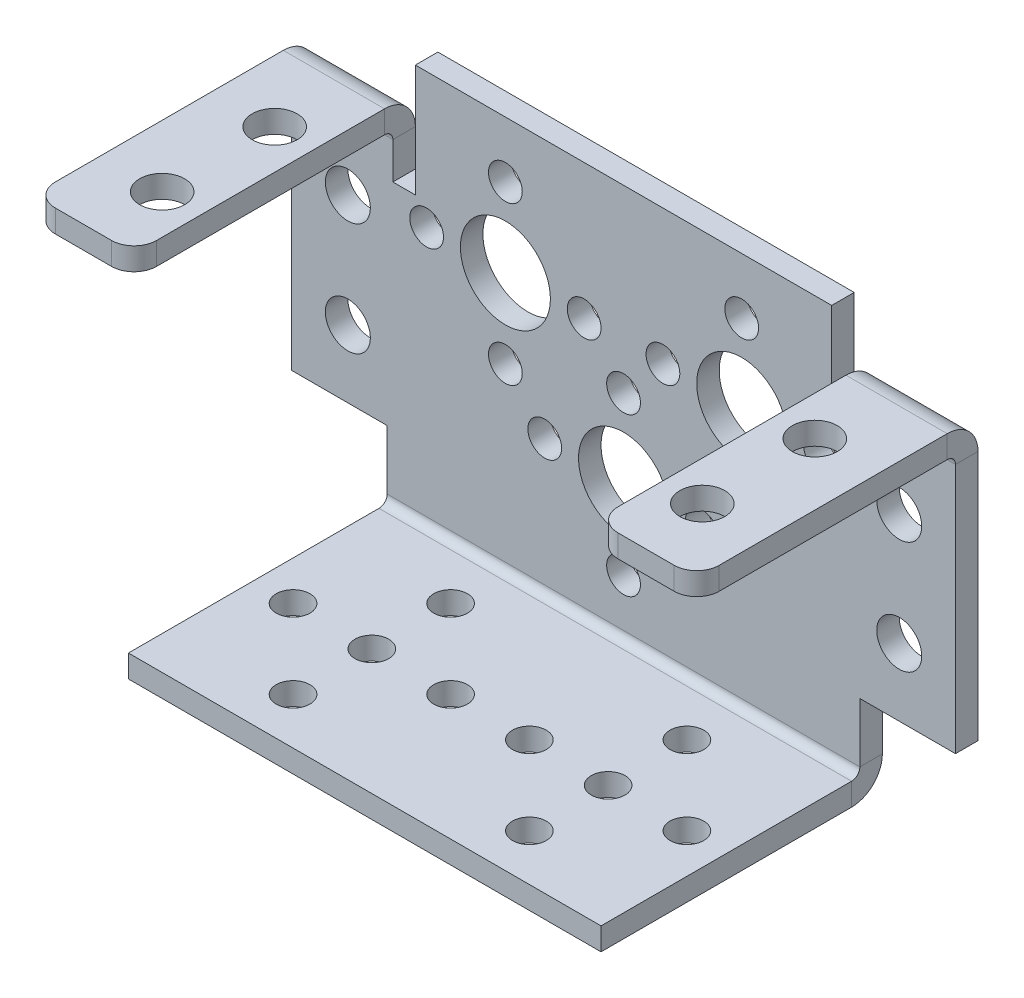
from build123d import *

# Parameters (mm, degrees)
SKETCH_1_R                         = 4
SKETCH_1_R_2                       = 1.5
SKETCH_1_R_3                       = 2
SM_BASE_FLANGE_1_DEPTH             = 2
SM_EDGE_FLANGE_1_STRIP_W           = 9.4732
SM_EDGE_FLANGE_1_STRIP_H           = 2
SM_EDGE_FLANGE_1_STRIP_CUT_DEPTH   = 9
SM_EDGE_FLANGE_1_STRIP_2_W         = 9.4732
SM_EDGE_FLANGE_1_STRIP_2_H         = 2
SM_EDGE_FLANGE_1_STRIP_CUT_2_DEPTH = 9
SM_EDGE_FLANGE_1_DEPTH             = 9
SM_EDGE_FLANGE_1_BEND_DEPTH        = 9
SM_EDGE_FLANGE_2_STRIP_W           = 9.4732
SM_EDGE_FLANGE_2_STRIP_H           = 2
SM_EDGE_FLANGE_2_STRIP_CUT_DEPTH   = 42
SM_EDGE_FLANGE_2_DEPTH             = 42
SKETCH_15_R                        = 1.5
CUT_EXTRUDE_1_DEPTH                = 10
SKETCH_16_R                        = 2
CUT_EXTRUDE_2_DEPTH                = 10
FILLET_1_R                         = 2


# Sheet-metal steps are written as plain solids
with BuildPart() as part:
    # Sketch 1 → 基体-法兰1 (new body)
    with BuildSketch(Plane.XY):
        Polygon((0, 0), (9, 0), (9, -6), (11, -6), (11, 4), (48, 4), (48, -6), (50, -6), (50, 0), (59, 0), (59, -25), (50.5, -25), (50.5, -33), (8.5, -33), (8.5, -25), (0, -25), align=None)
        with Locations((19, -8)):
            Circle(SKETCH_1_R, mode=Mode.SUBTRACT)
        with Locations((40, -8)):
            Circle(SKETCH_1_R, mode=Mode.SUBTRACT)
        with Locations((29.5, -19)):
            Circle(SKETCH_1_R, mode=Mode.SUBTRACT)
        with Locations((19, -1)):
            Circle(SKETCH_1_R_2, mode=Mode.SUBTRACT)
        with Locations((19, -15)):
            Circle(SKETCH_1_R_2, mode=Mode.SUBTRACT)
        with Locations((26, -8)):
            Circle(SKETCH_1_R_2, mode=Mode.SUBTRACT)
        with Locations((12, -8)):
            Circle(SKETCH_1_R_2, mode=Mode.SUBTRACT)
        with Locations(Location((33, -8, 0), (0, 0, 180))):
            Circle(SKETCH_1_R_2, mode=Mode.SUBTRACT)
        with Locations(Location((40, -15, 0), (0, 0, 180))):
            Circle(SKETCH_1_R_2, mode=Mode.SUBTRACT)
        with Locations(Location((47, -8, 0), (0, 0, 180))):
            Circle(SKETCH_1_R_2, mode=Mode.SUBTRACT)
        with Locations(Location((40, -1, 0), (0, 0, 180))):
            Circle(SKETCH_1_R_2, mode=Mode.SUBTRACT)
        with Locations((29.5, -12)):
            Circle(SKETCH_1_R_2, mode=Mode.SUBTRACT)
        with Locations((36.5, -19)):
            Circle(SKETCH_1_R_2, mode=Mode.SUBTRACT)
        with Locations((29.5, -26)):
            Circle(SKETCH_1_R_2, mode=Mode.SUBTRACT)
        with Locations((22.5, -19)):
            Circle(SKETCH_1_R_2, mode=Mode.SUBTRACT)
        with Locations((54, -9)):
            Circle(SKETCH_1_R_3, mode=Mode.SUBTRACT)
        with Locations((54, -19)):
            Circle(SKETCH_1_R_3, mode=Mode.SUBTRACT)
        with Locations((5, -19)):
            Circle(SKETCH_1_R_3, mode=Mode.SUBTRACT)
        with Locations((5, -9)):
            Circle(SKETCH_1_R_3, mode=Mode.SUBTRACT)
    extrude(amount=-SM_BASE_FLANGE_1_DEPTH)

    # 边线-法兰1 strip (across the edge) → 边线-法兰1 strip cut (cut)
    with BuildSketch(Plane(origin=(59, 0, 0), x_dir=(0, -1, 0), z_dir=(-1, 0, 0))):
        with Locations((-2, -1)):
            Rectangle(SM_EDGE_FLANGE_1_STRIP_W, SM_EDGE_FLANGE_1_STRIP_H)
    extrude(amount=SM_EDGE_FLANGE_1_STRIP_CUT_DEPTH, mode=Mode.SUBTRACT)

    # 边线-法兰1 strip 2 (across the edge) → 边线-法兰1 strip cut 2 (cut)
    with BuildSketch(Plane(origin=(9, 0, 0), x_dir=(0, -1, 0), z_dir=(-1, 0, 0))):
        with Locations((-2, -1)):
            Rectangle(SM_EDGE_FLANGE_1_STRIP_2_W, SM_EDGE_FLANGE_1_STRIP_2_H)
    extrude(amount=SM_EDGE_FLANGE_1_STRIP_CUT_2_DEPTH, mode=Mode.SUBTRACT)

    # 边线-法兰1 section (across the edge) → 边线-法兰1 (add)
    with BuildSketch(Plane(origin=(59, 0, 0), x_dir=(0, -1, 0), z_dir=(-1, 0, 0))):
        with BuildLine():
            Line((0, 0.7366), (0, 23))
            Line((0, 23), (2, 23))
            Line((2, 23), (2, 0.7366))
            ThreePointArc((2, 0.7366), (2.215745145, 0.215745145), (2.7366, 0))
            Line((2.7366, 0), (2.7366, -2))
            ThreePointArc((2.7366, -2), (0.801531583, -1.198468417), (0, 0.7366))
        make_face()
    extrude(amount=SM_EDGE_FLANGE_1_DEPTH)

    # 边线-法兰1 section 2 (across the edge) → 边线-法兰1 bend (add)
    with BuildSketch(Plane(origin=(9, 0, 0), x_dir=(0, -1, 0), z_dir=(-1, 0, 0))):
        with BuildLine():
            Line((0, 0.7366), (0, 23))
            Line((0, 23), (2, 23))
            Line((2, 23), (2, 0.7366))
            ThreePointArc((2, 0.7366), (2.215745145, 0.215745145), (2.7366, 0))
            Line((2.7366, 0), (2.7366, -2))
            ThreePointArc((2.7366, -2), (0.801531583, -1.198468417), (0, 0.7366))
        make_face()
    extrude(amount=SM_EDGE_FLANGE_1_BEND_DEPTH)

    # 边线-法兰2 strip (across the edge) → 边线-法兰2 strip cut (cut)
    with BuildSketch(Plane(origin=(8.5, -33, 0), x_dir=(0, 1, 0), z_dir=(1, 0, 0))):
        with Locations((-2, -1)):
            Rectangle(SM_EDGE_FLANGE_2_STRIP_W, SM_EDGE_FLANGE_2_STRIP_H)
    extrude(amount=SM_EDGE_FLANGE_2_STRIP_CUT_DEPTH, mode=Mode.SUBTRACT)

    # 边线-法兰2 section (across the edge) → 边线-法兰2 (add)
    with BuildSketch(Plane(origin=(8.5, -33, 0), x_dir=(0, 1, 0), z_dir=(1, 0, 0))):
        with BuildLine():
            Line((0, 0.7366), (0, 23))
            Line((0, 23), (2, 23))
            Line((2, 23), (2, 0.7366))
            ThreePointArc((2, 0.7366), (2.215745145, 0.215745145), (2.7366, 0))
            Line((2.7366, 0), (2.7366, -2))
            ThreePointArc((2.7366, -2), (0.801531583, -1.198468417), (0, 0.7366))
        make_face()
    extrude(amount=SM_EDGE_FLANGE_2_DEPTH)

    # 草图15 → 切除-拉伸1 (cut)
    with BuildSketch(Plane.XZ.offset(33)):
        with Locations(Location((47, 11.8683, 0), (0, 0, 270))):
            Circle(SKETCH_15_R)
        with Locations(Location((40, 11.8683, 0), (0, 0, 270))):
            Circle(SKETCH_15_R)
        with Locations(Location((33, 11.8683, 0), (0, 0, 270))):
            Circle(SKETCH_15_R)
        with Locations(Location((40, 4.8683, 0), (0, 0, 270))):
            Circle(SKETCH_15_R)
        with Locations(Location((40, 18.8683, 0), (0, 0, 270))):
            Circle(SKETCH_15_R)
        with Locations(Location((12, 11.8683, 0), (0, 0, 270))):
            Circle(SKETCH_15_R)
        with Locations(Location((19, 18.8683, 0), (0, 0, 270))):
            Circle(SKETCH_15_R)
        with Locations(Location((26, 11.8683, 0), (0, 0, 270))):
            Circle(SKETCH_15_R)
        with Locations(Location((19, 4.8683, 0), (0, 0, 270))):
            Circle(SKETCH_15_R)
        with Locations(Location((19, 11.8683, 0), (0, 0, 270))):
            Circle(SKETCH_15_R)
    extrude(amount=-CUT_EXTRUDE_1_DEPTH, mode=Mode.SUBTRACT)

    # 草图16 → 切除-拉伸2 (cut)
    with BuildSketch(Plane(origin=(0, 0, 0), x_dir=(1, 0, 0), z_dir=(0, 1, 0))):
        with Locations(Location((53.5, -17, 0), (0, 0, 270))):
            Circle(SKETCH_16_R)
        with Locations(Location((53.5, -7, 0), (0, 0, 270))):
            Circle(SKETCH_16_R)
        with Locations(Location((5.5, -17, 0), (0, 0, 90))):
            Circle(SKETCH_16_R)
        with Locations(Location((5.5, -7, 0), (0, 0, 90))):
            Circle(SKETCH_16_R)
    extrude(amount=-CUT_EXTRUDE_2_DEPTH, mode=Mode.SUBTRACT)

    # 圆角1
    fillet_1_edges = [part.edges().sort_by_distance(p)[0] for p in [
        (59, -1, 23),
        (50, -1, 23),
        (9, -1, 23),
        (0, -1, 23),
    ]]
    fillet(fillet_1_edges, radius=FILLET_1_R)


solid = part.part
